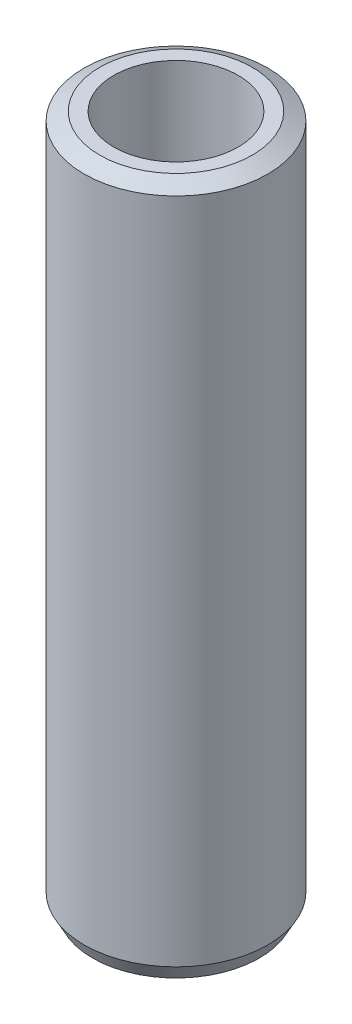
from build123d import *
from OCP.BRepFilletAPI import BRepFilletAPI_MakeChamfer

# Parameters (mm, degrees)
SKETCH1_R           = 57.5
BOSS_EXTRUDE1_DEPTH = 432.922423795
SKETCH2_R           = 38.926016868
CUT_EXTRUDE1_DEPTH  = 441.493274665
CHAMFER1_SIZE       = 5.317259134
CHAMFER1_SIZE2      = 9.802364417


with BuildPart() as part:
    # Sketch1 → Boss-Extrude1 (new body)
    with BuildSketch(Plane(origin=(0, 0, 0), x_dir=(1, 0, 0), z_dir=(0, 1, 0))):
        Circle(SKETCH1_R)
    extrude(amount=BOSS_EXTRUDE1_DEPTH)

    # Sketch2 → Cut-Extrude1 (cut, through all)
    with BuildSketch(Plane(origin=(0, 0, 0), x_dir=(1, 0, 0), z_dir=(0, 1, 0))):
        Circle(SKETCH2_R)
    extrude(amount=CUT_EXTRUDE1_DEPTH, mode=Mode.SUBTRACT)

    # Chamfer1: one chamfer whose edges measure the first distance from different faces: ONE call of the kernel's chamfer builder (chamfer() names one face for all edges)
    chamfer1_edges_1 = [part.edges().sort_by_distance(p)[0] for p in [
        (-57.5, 432.922423795, 0),
    ]]
    chamfer1_side_1 = [part.faces().sort_by_distance(p)[0] for p in [
        (-57.5, 216.461211898, 0),
    ]]
    chamfer1_edges_2 = [part.edges().sort_by_distance(p)[0] for p in [
        (-57.5, 0, 0),
    ]]
    chamfer1_side_2 = [part.faces().sort_by_distance(p)[0] for p in [
        (-55.873654403, 0, 0),
    ]]
    chamfer1 = BRepFilletAPI_MakeChamfer(part.part.solid().wrapped)
    for e in chamfer1_edges_1:
        chamfer1.Add(CHAMFER1_SIZE, CHAMFER1_SIZE2, e.wrapped, chamfer1_side_1[0].wrapped)  # the first distance lies on this face
    for e in chamfer1_edges_2:
        chamfer1.Add(CHAMFER1_SIZE, CHAMFER1_SIZE2, e.wrapped, chamfer1_side_2[0].wrapped)  # the first distance lies on this face
    add(Compound.cast(chamfer1.Shape()), mode=Mode.REPLACE)


solid = part.part
